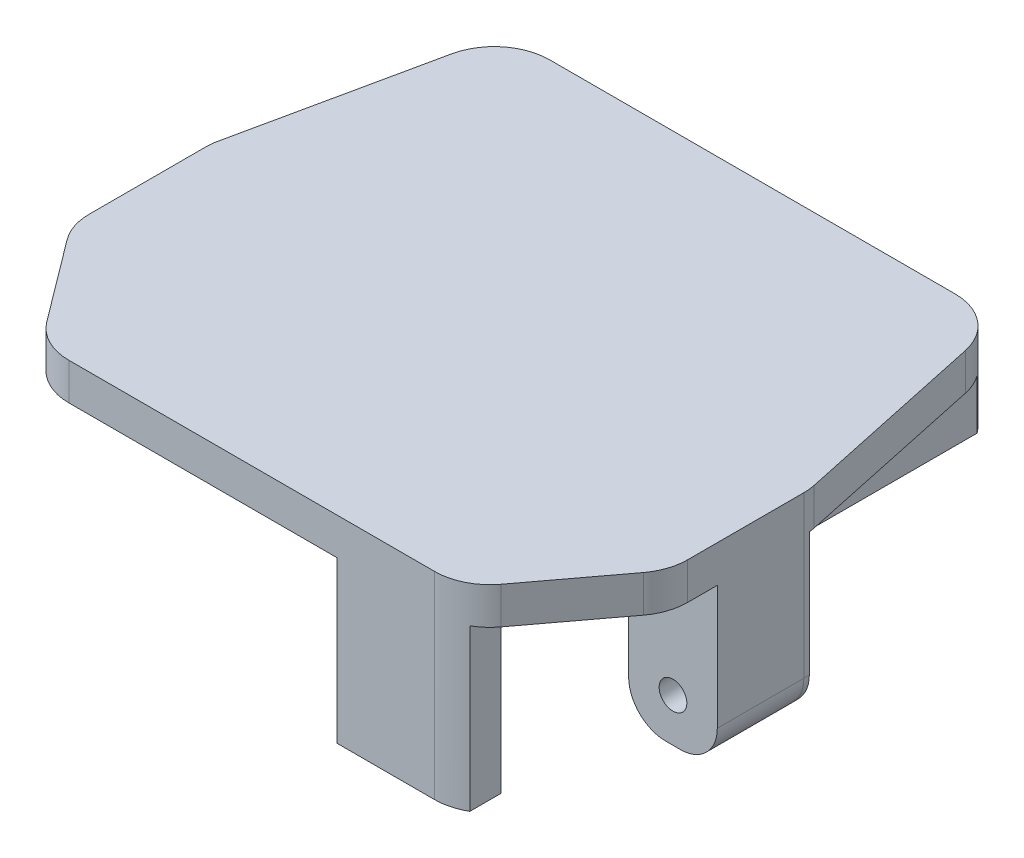
from build123d import *

# Parameters (mm, degrees)
BOSS_EXTRUDE1_START     = -14.7
BOSS_EXTRUDE1_OUTLINE_W = 32.4
BOSS_EXTRUDE1_OUTLINE_H = 27.1
BOSS_EXTRUDE1_DEPTH     = 14.7
CUT_EXTRUDE1_DEPTH      = 12.7
MOVE_FACE1_BY           = 4
MOVE_FACE1_2_BY         = 4
SKETCH3_W               = 2.8
SKETCH3_H               = 13.1
CUT_EXTRUDE2_DEPTH      = 13.7
CUT_EXTRUDE3_DEPTH      = 6
SKETCH5_R               = 0.75
CUT_EXTRUDE4_DEPTH      = 43.343439739
BOSS_EXTRUDE2_DEPTH     = 2
FILLET1_R               = 3
FILLET2_R               = 3
FILLET3_START           = -21
FILLET3_DEPTH           = 13
FILLET4_START           = -21
FILLET4_DEPTH           = 13
FILLET5_R               = 3
FILLET6_R               = 3
FILLET7_R               = 2


with BuildPart() as part:
    # Boss-Extrude1: read off the stored shape, not the designer's step
    # Boss-Extrude1 outline → Boss-Extrude1 (new body)
    with BuildSketch(Plane.XZ.offset(24.012143299).offset(BOSS_EXTRUDE1_START)):
        with Locations((16.432361385, -27.739579566)):
            Rectangle(BOSS_EXTRUDE1_OUTLINE_W, BOSS_EXTRUDE1_OUTLINE_H)
    extrude(amount=BOSS_EXTRUDE1_DEPTH)

    # Sketch2 → Cut-Extrude1 (cut)
    with BuildSketch(Plane.XZ.offset(24.012143299)):
        Polygon((27.832361385, -23.189579566), (32.632361385, -23.189579566), (32.632361385, -20.589579566), (27.832361385, -20.589579566), (27.832361385, -16.289579566), (5.032361385, -16.289579566), (5.032361385, -20.589579566), (0.232361385, -20.589579566), (0.232361385, -23.189579566), (5.032361385, -23.189579566), (5.032361385, -39.189579566), (27.832361385, -39.189579566), align=None)
    extrude(amount=-CUT_EXTRUDE1_DEPTH, mode=Mode.SUBTRACT)

    # Move Face1: a face moved inward by 4.0
    extrude(part.faces().sort_by_distance((16.432361385, -24.012143299, -39.479579566))[0], amount=MOVE_FACE1_BY, dir=(0, 1, 0), mode=Mode.SUBTRACT)

    # Move Face1 2: a face moved inward by 4.0
    extrude(part.faces().sort_by_distance((16.432361385, -24.012143299, -15.789579566))[0], amount=MOVE_FACE1_2_BY, dir=(0, 1, 0), mode=Mode.SUBTRACT)

    # Sketch3 → Cut-Extrude2 (cut)
    with BuildSketch(Plane.XZ.offset(20.012143299)):
        with Locations((1.632361385, -34.739579566)):
            Rectangle(SKETCH3_W, SKETCH3_H)
        with Locations((31.232361385, -34.739579566)):
            Rectangle(SKETCH3_W, SKETCH3_H)
        Polygon((0.232361385, -20.589579566), (5.032361385, -20.589579566), (5.032361385, -16.289579566), (21.032361385, -16.289579566), (21.032361385, -14.189579566), (0.232361385, -14.189579566), align=None)
        Polygon((27.832361385, -14.189579566), (32.632361385, -14.189579566), (32.632361385, -20.589579566), (27.832361385, -20.589579566), (27.832361385, -16.289579566), align=None)
    extrude(amount=-CUT_EXTRUDE2_DEPTH, mode=Mode.SUBTRACT)

    # Sketch4 → Cut-Extrude3 (cut)
    with BuildSketch(Plane.XZ.offset(20.012143299)):
        Polygon((3.032361385, -28.189579566), (5.032361385, -28.189579566), (5.032361385, -39.189579566), (27.832361385, -39.189579566), (27.832361385, -28.189579566), (29.832361385, -28.189579566), (29.832361385, -41.289579566), (3.032361385, -41.289579566), align=None)
    extrude(amount=-CUT_EXTRUDE3_DEPTH, mode=Mode.SUBTRACT)

    # Sketch5 → Cut-Extrude4 (cut, through all)
    with BuildSketch(Plane.XY.offset(-23.189579566)):
        with Locations((2.632361385, -17.662143299)):
            Circle(SKETCH5_R)
        with Locations((30.232361385, -17.662143299)):
            Circle(SKETCH5_R)
    extrude(amount=-CUT_EXTRUDE4_DEPTH, mode=Mode.SUBTRACT)

    # Sketch6 → Boss-Extrude2 (add)
    with BuildSketch(Plane(origin=(0, -9.312143299, 0), x_dir=(1, 0, 0), z_dir=(0, 1, 0))):
        Polygon((21.032361385, 14.189579566), (5.032361385, 14.189579566), (0.232361385, 20.589579566), (5.032361385, 20.589579566), (5.032361385, 16.289579566), (21.032361385, 16.289579566), align=None)
        Polygon((0.232361385, 28.189579566), (3.032361385, 41.289579566), (3.032361385, 28.189579566), align=None)
        Polygon((29.832361385, 41.289579566), (29.832361385, 28.189579566), (32.632361385, 28.189579566), align=None)
        Polygon((27.832361385, 20.589579566), (27.832361385, 14.189579566), (32.632361385, 20.589579566), align=None)
    extrude(amount=-BOSS_EXTRUDE2_DEPTH)

    # Fillet1
    # the kernel refuses this fillet: 3 mm, written as the material it takes off along each edge
    with BuildSketch(Plane(origin=(29.832361385, -17.378495337, -41.289579566), x_dir=(0.20901925718607187, 0, 0.9779115246919747), z_dir=(0, 1, 0))) as fillet1_piece_1:
        with BuildLine():
            CenterArc((FILLET1_R * 0.808846938434, -FILLET1_R), FILLET1_R, 90, 77.935115589)
            Line((-FILLET1_R * 0.169064586258, -FILLET1_R * 0.790980742814), (0, 0))
            Line((0, 0), (FILLET1_R * 0.808846938434, 0))
        make_face()
    extrude(amount=14.132704077, mode=Mode.SUBTRACT)

    # Fillet2
    # the kernel refuses this fillet: 3 mm, written as the material it takes off along each edge
    with BuildSketch(Plane(origin=(3.032361385, -17.378495337, -41.289579566), x_dir=(1.0, 0, -8.828560948914946e-12), z_dir=(0, 1, 0))) as fillet2_piece_1:
        with BuildLine():
            CenterArc((FILLET2_R * 0.808846938434, -FILLET2_R), FILLET2_R, 89.999999999, 77.935115589)
            Line((-FILLET2_R * 0.169064586256, -FILLET2_R * 0.790980742805), (0, 0))
            Line((0, 0), (FILLET2_R * 0.808846938443, 0))
        make_face()
    extrude(amount=14.132704077, mode=Mode.SUBTRACT)

    # Fillet3: read off the stored shape, not the designer's step
    # Fillet3 outline → Fillet3 (cut)
    with BuildSketch(Plane(origin=(0, 0, 0), x_dir=(1, 0, 0), z_dir=(0, 1, 0)).offset(FILLET3_START)):
        with BuildLine():
            Line((0.232361385, 28.189579566), (0.232361385, 27.872549323))
            ThreePointArc((0.232361385, 27.872549323), (0.248973736, 28.187824027), (0.29862681, 28.499607094))
            Line((0.29862681, 28.499607094), (0.232361385, 28.189579566))
        make_face()
    extrude(amount=FILLET3_DEPTH, mode=Mode.SUBTRACT)

    # Fillet4: read off the stored shape, not the designer's step
    # Fillet4 outline → Fillet4 (cut)
    with BuildSketch(Plane(origin=(0, 0, 0), x_dir=(1, 0, 0), z_dir=(0, 1, 0)).offset(FILLET4_START)):
        with BuildLine():
            Line((32.632361385, 28.189579566), (32.566095959, 28.499607094))
            ThreePointArc((32.566095959, 28.499607094), (32.615749033, 28.187824027), (32.632361385, 27.872549323))
            Line((32.632361385, 27.872549323), (32.632361385, 28.189579566))
        make_face()
    extrude(amount=FILLET4_DEPTH, mode=Mode.SUBTRACT)

    # Fillet5
    fillet5_edges = [part.edges().sort_by_distance(p)[0] for p in [
        (32.632361385, -10.312143299, -20.589579566),
        (5.032361385, -10.312143299, -14.189579566),
        (0.232361385, -10.312143299, -20.589579566),
    ]]
    fillet(fillet5_edges, radius=FILLET5_R)

    # Fillet6
    # the kernel refuses this fillet: 3 mm, written as the material it takes off along each edge
    with BuildSketch(Plane(origin=(27.832361385, -20.312143299, -14.189579566), x_dir=(-1.0, 0, -1.4283093226823923e-11), z_dir=(0, 1, 0))) as fillet6_piece_1:
        with BuildLine():
            CenterArc((FILLET6_R * 0.500000000009, -FILLET6_R), FILLET6_R, 90.000000001, 53.130102354)
            Line((-FILLET6_R * 0.3, -FILLET6_R * 0.400000000011), (-FILLET6_R * 0.316, -FILLET6_R * 0.388000000012))
            Line((-FILLET6_R * 0.316, -FILLET6_R * 0.388000000012), (-FILLET6_R * 0.0100000000003, FILLET6_R * 0.0199999999999))
            Line((-FILLET6_R * 0.0100000000003, FILLET6_R * 0.0199999999999), (FILLET6_R * 0.499999999994, FILLET6_R * 0.02))
            Line((FILLET6_R * 0.499999999994, FILLET6_R * 0.02), (FILLET6_R * 0.499999999995, 0))
        make_face()
    extrude(amount=20, mode=Mode.SUBTRACT)

    # Fillet7
    fillet7_edges = [part.edges().sort_by_distance(p)[0] for p in [
        (0.232361385, -20.012143299, -25.531064444),
        (27.832361385, -20.012143299, -25.689579566),
        (0.236563927, -20.012143299, -28.031286811),
        (32.632361385, -20.012143299, -25.531064444),
        (32.628158843, -20.012143299, -28.031286811),
        (5.032361385, -20.012143299, -25.689579566),
    ]]
    fillet(fillet7_edges, radius=FILLET7_R)


solid = part.part
